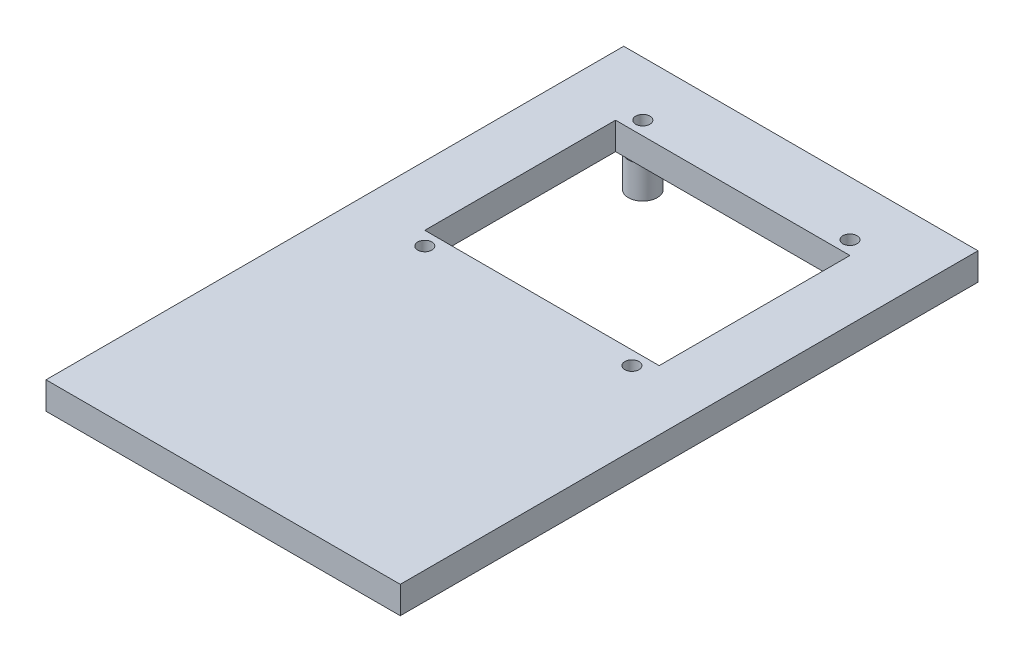
from build123d import *

# Parameters (mm, degrees)
SKETCH3_W           = 65
SKETCH3_H           = 60
BOSS_EXTRUDE3_DEPTH = 5
SKETCH5_W           = 43
SKETCH5_H           = 35
CUT_EXTRUDE2_DEPTH  = 10
CUT_EXTRUDE1_REACH  = 57.982
SKETCH4_R           = 1.3
SKETCH9_R           = 2.65
SKETCH9_R_2         = 1.05
BOSS_EXTRUDE5_DEPTH = 6
SKETCH11_W          = 65
SKETCH11_H          = 5
BOSS_EXTRUDE7_DEPTH = 46


with BuildPart() as part:
    # Sketch3 → Boss-Extrude3 (new body)
    with BuildSketch(Plane(origin=(0, 0, 0), x_dir=(1, 0, 0), z_dir=(0, 1, 0))):
        with Locations((-14.5, 0)):
            Rectangle(SKETCH3_W, SKETCH3_H)
    extrude(amount=BOSS_EXTRUDE3_DEPTH)

    # Sketch5 → Cut-Extrude2 (cut)
    with BuildSketch(Plane.XZ):
        with Locations((-14.5, 0)):
            Rectangle(SKETCH5_W, SKETCH5_H)
    extrude(amount=-CUT_EXTRUDE2_DEPTH, mode=Mode.SUBTRACT)

    # Sketch4 → Cut-Extrude1 (cut, up to next)
    with BuildSketch(Plane(origin=(0, 5, 0), x_dir=(1, 0, 0), z_dir=(0, 1, 0)), mode=Mode.PRIVATE) as cut_extrude1_sk1:
        with Locations((-33.5, 20)):
            Circle(SKETCH4_R)
    cut_extrude1_tool1 = extrude(cut_extrude1_sk1.sketch, amount=-CUT_EXTRUDE1_REACH, mode=Mode.PRIVATE) & part.part
    # Sketch4 → Cut-Extrude1 (cut, up to next)
    with BuildSketch(Plane(origin=(0, 5, 0), x_dir=(1, 0, 0), z_dir=(0, 1, 0)), mode=Mode.PRIVATE) as cut_extrude1_sk2:
        with Locations((4.5, 20)):
            Circle(SKETCH4_R)
    cut_extrude1_tool2 = extrude(cut_extrude1_sk2.sketch, amount=-CUT_EXTRUDE1_REACH, mode=Mode.PRIVATE) & part.part
    # Sketch4 → Cut-Extrude1 (cut, up to next)
    with BuildSketch(Plane(origin=(0, 5, 0), x_dir=(1, 0, 0), z_dir=(0, 1, 0)), mode=Mode.PRIVATE) as cut_extrude1_sk3:
        with Locations((4.5, -20)):
            Circle(SKETCH4_R)
    cut_extrude1_tool3 = extrude(cut_extrude1_sk3.sketch, amount=-CUT_EXTRUDE1_REACH, mode=Mode.PRIVATE) & part.part
    # Sketch4 → Cut-Extrude1 (cut, up to next)
    with BuildSketch(Plane(origin=(0, 5, 0), x_dir=(1, 0, 0), z_dir=(0, 1, 0)), mode=Mode.PRIVATE) as cut_extrude1_sk4:
        with Locations((-33.5, -20)):
            Circle(SKETCH4_R)
    cut_extrude1_tool4 = extrude(cut_extrude1_sk4.sketch, amount=-CUT_EXTRUDE1_REACH, mode=Mode.PRIVATE) & part.part
    add(cut_extrude1_tool1.solids().sort_by_distance((-33.5, 5, -20))[0], mode=Mode.SUBTRACT)
    add(cut_extrude1_tool2.solids().sort_by_distance((4.5, 5, -20))[0], mode=Mode.SUBTRACT)
    add(cut_extrude1_tool3.solids().sort_by_distance((4.5, 5, 20))[0], mode=Mode.SUBTRACT)
    add(cut_extrude1_tool4.solids().sort_by_distance((-33.5, 5, 20))[0], mode=Mode.SUBTRACT)

    # Sketch9 → Boss-Extrude5 (add)
    # profile 1 of 4: a face of its own
    with BuildSketch(Plane.XZ):
        with Locations((-33.5, 20)):
            Circle(SKETCH9_R)
        with Locations((-33.5, 20)):
            Circle(SKETCH9_R_2, mode=Mode.SUBTRACT)
    # profile 2 of 4: a face of its own
    with BuildSketch(Plane.XZ):
        with Locations((-33.5, -20)):
            Circle(SKETCH9_R)
        with Locations((-33.5, -20)):
            Circle(SKETCH9_R_2, mode=Mode.SUBTRACT)
    # profile 3 of 4: a face of its own
    with BuildSketch(Plane.XZ):
        with Locations((4.5, 20)):
            Circle(SKETCH9_R)
        with Locations((4.5, 20)):
            Circle(SKETCH9_R_2, mode=Mode.SUBTRACT)
    # profile 4 of 4: a face of its own
    with BuildSketch(Plane.XZ):
        with Locations((4.5, -20)):
            Circle(SKETCH9_R)
        with Locations((4.5, -20)):
            Circle(SKETCH9_R_2, mode=Mode.SUBTRACT)
    extrude(amount=BOSS_EXTRUDE5_DEPTH)

    # Sketch11 → Boss-Extrude7 (add)
    with BuildSketch(Plane.XY.offset(30)):
        with Locations((-14.5, 2.5)):
            Rectangle(SKETCH11_W, SKETCH11_H)
    extrude(amount=BOSS_EXTRUDE7_DEPTH)


solid = part.part
